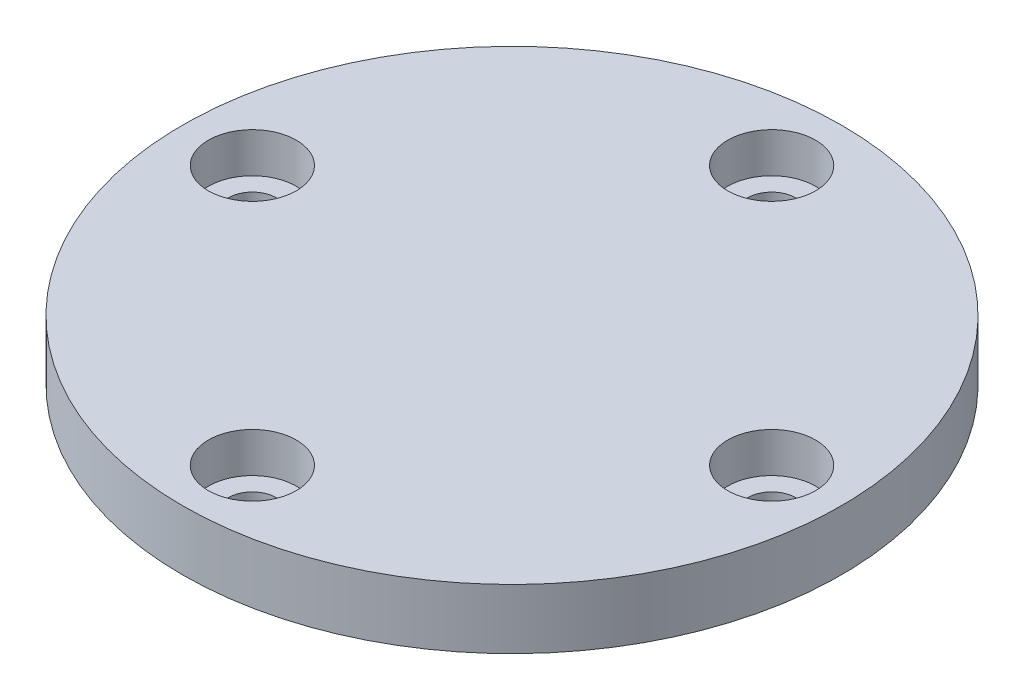
from build123d import *

# Parameters (mm, degrees)
SKETCH1_R                      = 16.5
BOSS_EXTRUDE1_DEPTH            = 3
CBORE_FOR_M2_SHCS1_D           = 2.4
CBORE_FOR_M2_SHCS1_CBORE_D     = 4.4
CBORE_FOR_M2_SHCS1_CBORE_DEPTH = 2
CIRPATTERN1_COUNT              = 4


with BuildPart() as part:
    # Sketch1 → Boss-Extrude1 (new body)
    with BuildSketch(Plane(origin=(0, 0, 0), x_dir=(1, 0, 0), z_dir=(0, 1, 0))):
        Circle(SKETCH1_R)
    extrude(amount=BOSS_EXTRUDE1_DEPTH)

    # CBORE for M2 SHCS1 (through all)
    with Locations(Plane(origin=(0, 3, 0), x_dir=(1, 0, 0), z_dir=(0, 1, 0))):
        with Locations((-13, 0)):
            cbore_for_m2_shcs1 = CounterBoreHole(CBORE_FOR_M2_SHCS1_D / 2, CBORE_FOR_M2_SHCS1_CBORE_D / 2, CBORE_FOR_M2_SHCS1_CBORE_DEPTH)

    # CirPattern1: CBORE for M2 SHCS1 ×4 about axis
    cirpattern1_axis = Axis((0, 3, 0), (0, 1, 0))
    for i in range(1, CIRPATTERN1_COUNT):
        add(cbore_for_m2_shcs1.rotate(cirpattern1_axis, i * 360 / CIRPATTERN1_COUNT), mode=Mode.SUBTRACT)


solid = part.part
